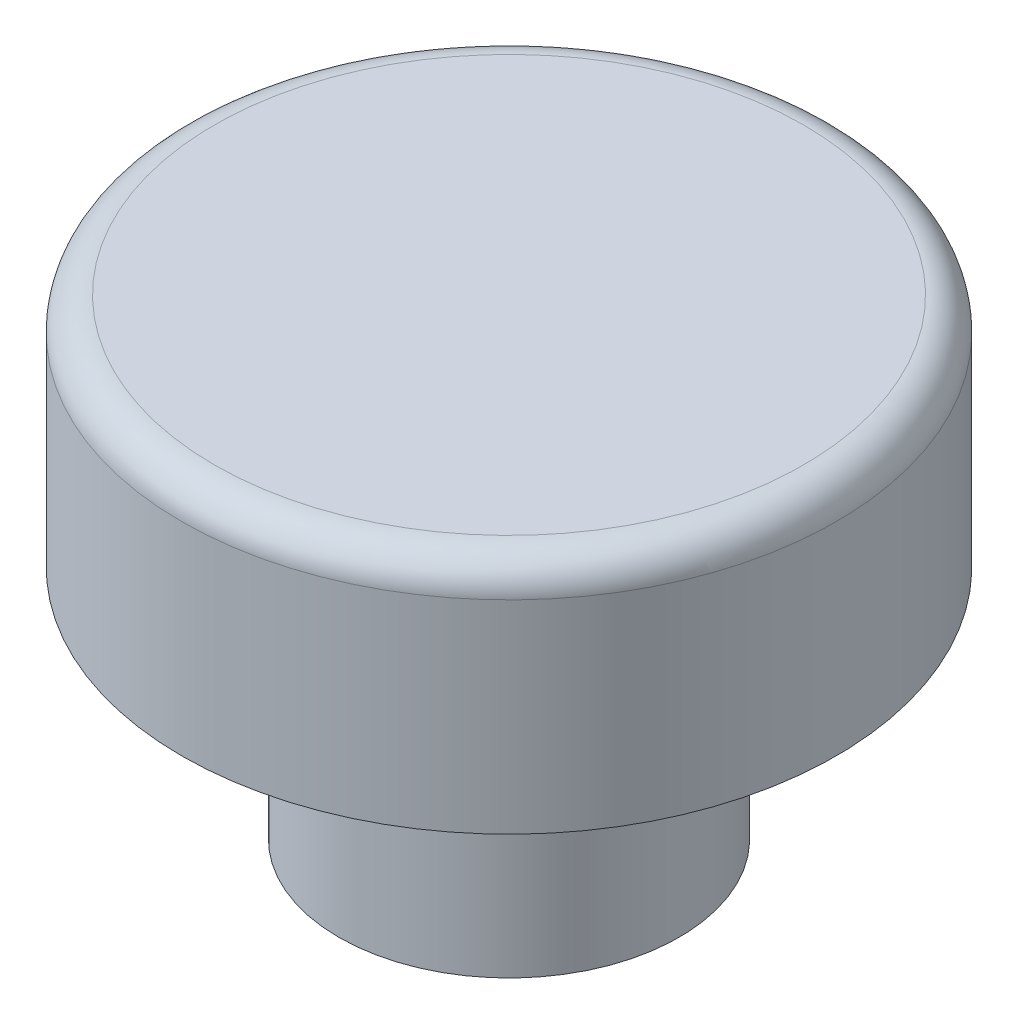
from build123d import *

# Parameters (mm, degrees)
SKETCH1_R          = 2.6
STEM_HOUSING_DEPTH = 3.6
SKETCH2_R          = 5
BUTTON_HEAD_DEPTH  = 3.6
FILLET1_R          = 0.5


with BuildPart() as part:
    # Sketch1 → stem housing (new body)
    with BuildSketch(Plane(origin=(0, 0, 0), x_dir=(1, 0, 0), z_dir=(0, 1, 0))):
        Circle(SKETCH1_R)
        with BuildLine():
            Line((-0.585, 0.885), (-0.585, 2.05))
            Line((-0.585, 2.05), (0.585, 2.05))
            Line((0.585, 2.05), (0.585, 0.885))
            ThreePointArc((0.585, 0.885), (0.672867966, 0.672867966), (0.885, 0.585))
            Line((0.885, 0.585), (2.05, 0.585))
            Line((2.05, 0.585), (2.05, -0.585))
            Line((2.05, -0.585), (0.885, -0.585))
            ThreePointArc((0.885, -0.585), (0.672867966, -0.672867966), (0.585, -0.885))
            Line((0.585, -0.885), (0.585, -2.05))
            Line((0.585, -2.05), (-0.585, -2.05))
            Line((-0.585, -2.05), (-0.585, -0.885))
            ThreePointArc((-0.585, -0.885), (-0.672867966, -0.672867966), (-0.885, -0.585))
            Line((-0.885, -0.585), (-2.05, -0.585))
            Line((-2.05, -0.585), (-2.05, 0.585))
            Line((-2.05, 0.585), (-0.885, 0.585))
            ThreePointArc((-0.885, 0.585), (-0.672867966, 0.672867966), (-0.585, 0.885))
        make_face(mode=Mode.SUBTRACT)
    extrude(amount=STEM_HOUSING_DEPTH)

    # Sketch2 → button head (add)
    with BuildSketch(Plane(origin=(0, 3.6, 0), x_dir=(1, 0, 0), z_dir=(0, 1, 0))):
        Circle(SKETCH2_R)
    extrude(amount=BUTTON_HEAD_DEPTH)

    # Fillet1
    fillet1_edges = [part.edges().sort_by_distance(p)[0] for p in [
        (-5, 7.2, 0),
    ]]
    fillet(fillet1_edges, radius=FILLET1_R)


solid = part.part
